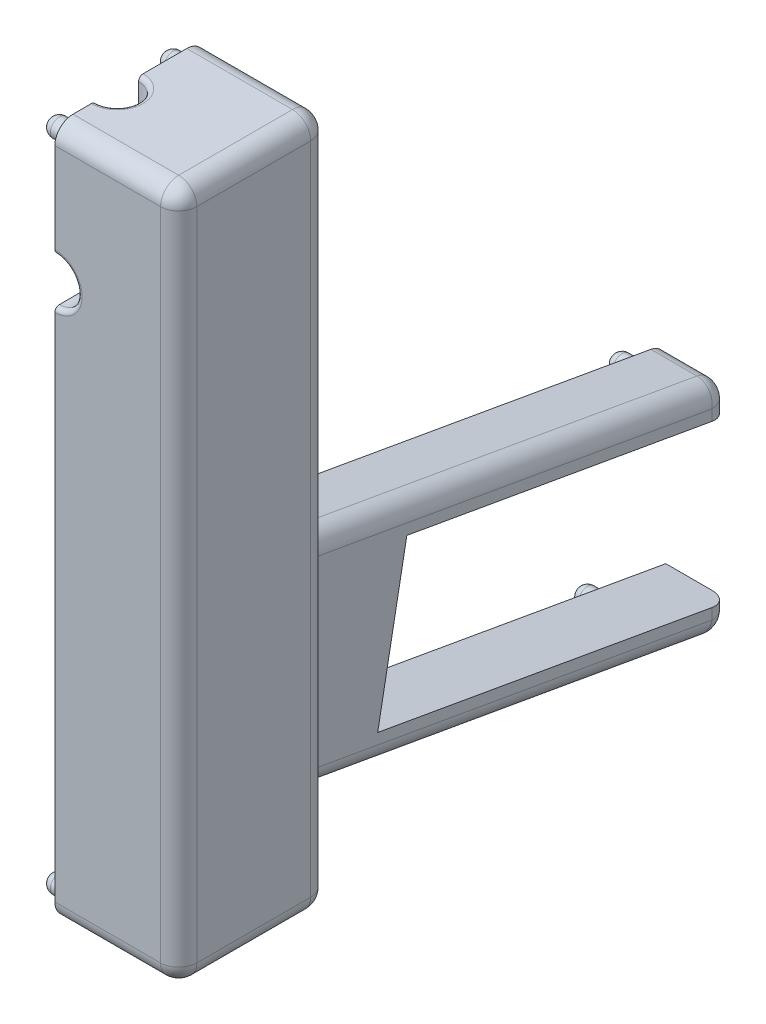
from build123d import *

# Parameters (mm, degrees)
SKETCH1_W                = 27.305
SKETCH1_H                = 33.1
BOSS_EXTRUDE1_DEPTH      = 152.4
SKETCH2_W                = 20.4
SKETCH2_H                = 139.7
CUT_EXTRUDE1_DEPTH       = 19.05
HITLED_REACH             = 160.325
SKETCH6_W                = 6.35
SKETCH6_H                = 74.93
PCB_DEPTH                = 6.35
SKETCH16_R               = 2
PRESSFIT_DEPTH           = 5
FILLET_PRESSFIT_R        = 2
BUTT_DEPTH               = 14.175
BATTERYPACK_DEPTH        = 14.175
SKETCH22_R               = 2
PRESSFIT_BOTTOM_DEPTH    = 5
IRLED_REACH              = 206.379
FILLET_BODY_R            = 4
FILLET_PRESSFIT_BOTTOM_R = 2
FILLET_LED_S_R           = 1
CUT_EXTRUDE2_DEPTH       = 3.5
CUT_EXTRUDE3_DEPTH       = 12.065
CUT_EXTRUDE4_DEPTH       = 7.825


with BuildPart() as part:
    # Sketch1 → Boss-Extrude1 (new body)
    with BuildSketch(Plane(origin=(0, 0, 0), x_dir=(1, 0, 0), z_dir=(0, 1, 0))):
        with Locations((13.6525, 16.55)):
            Rectangle(SKETCH1_W, SKETCH1_H)
    extrude(amount=BOSS_EXTRUDE1_DEPTH)

    # Sketch2 → Cut-Extrude1 (cut)
    with BuildSketch(Plane.ZY):
        with Locations((-16.55, 76.2)):
            Rectangle(SKETCH2_W, SKETCH2_H)
    extrude(amount=-CUT_EXTRUDE1_DEPTH, mode=Mode.SUBTRACT)

    # Sketch3 → HitLED (cut, up to next)
    with BuildSketch(Plane.XY, mode=Mode.PRIVATE) as hitled_sk1:
        with BuildLine():
            Line((0, 127.555), (0, 117.555))
            ThreePointArc((0, 117.555), (5, 122.555), (0, 127.555))
        make_face()
    hitled_tool1 = extrude(hitled_sk1.sketch, amount=-HITLED_REACH, mode=Mode.PRIVATE) & part.part
    add(hitled_tool1.solids().sort_by_distance((2.122066, 122.555, 0))[0], mode=Mode.SUBTRACT)

    # Sketch6 → PCB (add)
    with BuildSketch(Plane.ZY.offset(-19.05)):
        with Locations((-12.525, 70.485)):
            Rectangle(SKETCH6_W, SKETCH6_H)
        with Locations((-20.575, 70.485)):
            Rectangle(SKETCH6_W, SKETCH6_H)
    extrude(amount=PCB_DEPTH)

    # Sketch16 → PressFit (add)
    with BuildSketch(Plane.ZY):
        with Locations((-4, 148.4)):
            Circle(SKETCH16_R)
        with Locations((-4, 4)):
            Circle(SKETCH16_R)
        with Locations((-29.1, 148.4)):
            Circle(SKETCH16_R)
        with Locations((-29.1, 4)):
            Circle(SKETCH16_R)
    extrude(amount=PRESSFIT_DEPTH)

    # Fillet-PressFit
    fillet_pressfit_edges = [part.edges().sort_by_distance(p)[0] for p in [
        (-5, 4, -31.1),
        (-5, 4, -6),
        (-5, 148.4, -31.1),
        (-5, 148.4, -6),
    ]]
    fillet(fillet_pressfit_edges, radius=FILLET_PRESSFIT_R)

    # Sketch23 → Butt (add)
    with BuildSketch(Plane(origin=(0, 0, -25.4), x_dir=(0, 0, 1), z_dir=(-1, 0, 0))):
        Polygon((-7.7, 61.135849387), (-7.7, 12.7), (-109.3, -5.21482124), (-109.3, 43.221028147), align=None)
    extrude(amount=-BUTT_DEPTH)

    # Sketch20 → BatteryPack (cut)
    with BuildSketch(Plane.ZY):
        Polygon((-63.435596448, 49.338906272), (-57.003300004, 14.933162267), (-123.973771116, 3.124461299), (-134.7, 1.233137745), (-134.7, 36.773069161), (-130.40606756, 37.530205304), align=None)
    extrude(amount=-BATTERYPACK_DEPTH, mode=Mode.SUBTRACT)

    # Sketch22 → PressFit - Bottom (add)
    with BuildSketch(Plane.ZY):
        with Locations((-128.066987256, 41.166627764)):
            Circle(SKETCH22_R)
        with Locations((-120.442926047, 0.523065057)):
            Circle(SKETCH22_R)
    extrude(amount=PRESSFIT_BOTTOM_DEPTH)

    # Sketch25 → IRLED (cut, up to next)
    with BuildSketch(Plane.XZ.offset(-146.05), mode=Mode.PRIVATE) as irled_sk1:
        with BuildLine():
            Line((0, -9.05), (0, -18.45))
            ThreePointArc((0, -18.45), (4.7, -13.75), (0, -9.05))
        make_face()
    irled_tool1 = extrude(irled_sk1.sketch, amount=-IRLED_REACH, mode=Mode.PRIVATE) & part.part
    add(irled_tool1.solids().sort_by_distance((1.994742, 146.05, -13.75))[0], mode=Mode.SUBTRACT)

    # Fillet - Body
    fillet_body_edges = [part.edges().sort_by_distance(p)[0] for p in [
        (14.175, -1.990841747, -134.7),
        (14.175, 39.997048654, -134.7),
        (7.0875, 43.221028147, -134.7),
        (7.0875, -5.21482124, -134.7),
        (14.175, 52.178438767, -83.9),
        (14.175, 3.74258938, -83.9),
        (7.0875, 12.7, -33.1),
        (14.175, 36.917924693, -33.1),
        (7.0875, 61.135849387, -33.1),
        (13.6525, 152.4, -33.1),
        (13.6525, 152.4, 0),
        (27.305, 152.4, -16.55),
        (27.305, 76.2, -33.1),
        (27.305, 0, -16.55),
        (13.6525, 0, -33.1),
        (13.6525, 0, 0),
        (27.305, 76.2, 0),
    ]]
    fillet(fillet_body_edges, radius=FILLET_BODY_R)

    # Fillet-PressFit-Bottom
    fillet_pressfit_bottom_edges = [part.edges().sort_by_distance(p)[0] for p in [
        (-5, 0.523065057, -122.442926047),
        (-5, 41.166627764, -130.066987256),
    ]]
    fillet(fillet_pressfit_bottom_edges, radius=FILLET_PRESSFIT_BOTTOM_R)

    # Fillet-LED's
    fillet_led_s_edges = [part.edges().sort_by_distance(p)[0] for p in [
        (4.7, 152.4, -13.75),
        (5, 122.555, 0),
    ]]
    fillet(fillet_led_s_edges, radius=FILLET_LED_S_R)

    # Sketch26 → Cut-Extrude2 (cut)
    with BuildSketch(Plane.ZY):
        Polygon((-46.717974009, 58.734633147), (-53.61162828, 57.519095903), (-52.986494841, 53.973787992), (-46.09284057, 55.189325236), align=None)
    extrude(amount=-CUT_EXTRUDE2_DEPTH, mode=Mode.SUBTRACT)

    # Sketch27 → Cut-Extrude3 (cut)
    with BuildSketch(Plane.ZY):
        Polygon((-40.159373858, 56.235555506), (-58.919961553, 52.927557722), (-58.62475965, 51.253384541), (-39.864171956, 54.561382326), align=None)
    extrude(amount=-CUT_EXTRUDE3_DEPTH, mode=Mode.SUBTRACT)

    # Sketch28 → Cut-Extrude4 (cut)
    with BuildSketch(Plane.ZY):
        Polygon((-46.290042544, 53.428327967), (-52.198889062, 52.386438901), (-47.85768462, 27.766245075), (-41.948838102, 28.808134141), align=None)
    extrude(amount=-CUT_EXTRUDE4_DEPTH, mode=Mode.SUBTRACT)


solid = part.part
